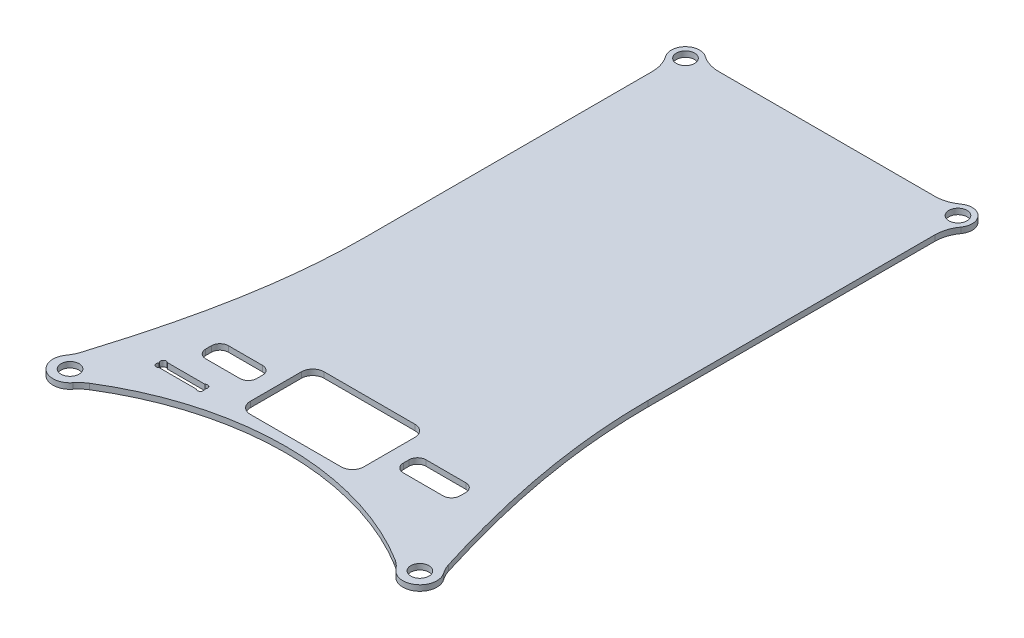
from build123d import *

# Parameters (mm, degrees)
COVER_MAIN_BOARD_1_START = 30
COVER_MAIN_BOARD_1_DEPTH = 1
SKETCH_2_R               = 2.5
SKETCH_2_R_2             = 3
EXTRUDE_1_DEPTH          = 1
FILLET_1_R               = 6
HOLE_WIZARD_M31_D        = 3.2
SKETCH_5_W               = 20
SKETCH_5_H               = 13
CUT_EXTRUDE_2_DEPTH      = 118.861812366
FILLET_2_R               = 2
CUT_EXTRUDE_3_DEPTH      = 118.861812366
SKETCH_7_W               = 10
SKETCH_7_H               = 4
SKETCH_7_W_2             = 9
CUT_EXTRUDE_4_DEPTH      = 118.861812366
FILLET_3_R               = 1.5


# Read off the part's stored shape, not the designer's step: Припуск-Cover_main_board-1
with BuildPart() as part:
    # Припуск-Cover_main_board-1 outline → Припуск-Cover_main_board-1 (new body)
    with BuildSketch(Plane(origin=(0, 0, 0), x_dir=(1, 0, 0), z_dir=(0, 1, 0)).offset(COVER_MAIN_BOARD_1_START)):
        with BuildLine():
            ThreePointArc((58.536662962, -97.610509717), (61.872887908, -97.542255565), (62.936422695, -94.379353532))
            add(Edge.make_bspline(
                [(62.936422695, -94.379353532), (61.798177223, -90.776493028), (60.72075986, -87.155811957), (58.774674414, -79.85329338), (57.908149184, -76.177190929), (56.466060339, -68.758031881), (55.893308454, -65.032046108), (55.109773151, -57.544971093), (54.899999704, -53.783069267), (54.9, -50)],
                knots=[0, 0, 0, 0, 0.25, 0.25, 0.5, 0.5, 0.75, 0.75, 1, 1, 1, 1], degree=3))
            Line((54.9, -50), (54.9, 6.4))
            Line((54.9, 6.4), (5.1, 6.4))
            Line((5.1, 6.4), (5.1, -50))
            add(Edge.make_bspline(
                [(5.1, -50), (5.099991031, -53.776486453), (4.890826579, -57.541590974), (4.10432522, -65.051764617), (3.53002006, -68.780548712), (2.088476888, -76.191600122), (1.222062078, -79.86132679), (-0.718312327, -87.143485068), (-1.7924779, -90.75713228), (-2.928662588, -94.354417399)],
                knots=[0, 0, 0, 0, 0.25, 0.25, 0.5, 0.5, 0.75, 0.75, 1, 1, 1, 1], degree=3))
            ThreePointArc((-2.928662588, -94.354417399), (-1.883263044, -97.534459074), (1.463338472, -97.610508751))
            ThreePointArc((1.463338472, -97.610508751), (30.000000864, -88.89999981), (58.536662962, -97.610509717))
        make_face()
    extrude(amount=COVER_MAIN_BOARD_1_DEPTH)

    # Эскиз2 → Бобышка-Вытянуть1 (add)
    with BuildSketch(Plane(origin=(0, 31, 0), x_dir=(1, 0, 0), z_dir=(0, 1, 0))):
        with Locations((6, 5.5)):
            Circle(SKETCH_2_R)
        with Locations((54, 5.5)):
            Circle(SKETCH_2_R)
        with Locations((-0.811267397, -96.088490424)):
            Circle(SKETCH_2_R_2)
        with Locations((60.811267397, -96.088490424)):
            Circle(SKETCH_2_R_2)
    extrude(amount=-EXTRUDE_1_DEPTH)

    # Скругление1
    fillet_1_edges = [part.edges().sort_by_distance(p)[0] for p in [
        (-2.75519034, 30.5, 93.803503862),
        (1.934506666, 30.5, 97.297094907),
        (58.065493335, 30.5, 97.297094908),
        (62.755023846, 30.5, 93.803362229),
        (54.9, 30.5, -3.167619242),
        (51.667619242, 30.5, -6.4),
        (8.332380758, 30.5, -6.4),
        (5.1, 30.5, -3.167619242),
    ]]
    fillet(fillet_1_edges, radius=FILLET_1_R)

    # Отверстие с зазором M31 (through all)
    with Locations(Plane(origin=(0, 31, 0), x_dir=(1, 0, 0), z_dir=(0, 1, 0))):
        with Locations((-0.811267397, -96.088490424), (60.811267397, -96.088490424), (54, 5.5), (6, 5.5)):
            Hole(HOLE_WIZARD_M31_D / 2)

    # Эскиз5 → Вырез-Вытянуть2 (cut, through all)
    with BuildSketch(Plane.XZ.offset(-30)):
        with Locations((30, 80.64999981)):
            Rectangle(SKETCH_5_W, SKETCH_5_H)
    extrude(amount=-CUT_EXTRUDE_2_DEPTH, mode=Mode.SUBTRACT)

    # Скругление2
    fillet_2_edges = [part.edges().sort_by_distance(p)[0] for p in [
        (40, 30.5, 87.14999981),
        (40, 30.5, 74.14999981),
        (20, 30.5, 74.14999981),
        (20, 30.5, 87.14999981),
    ]]
    fillet(fillet_2_edges, radius=FILLET_2_R)

    # Эскиз6 → Вырез-Вытянуть3 (cut, through all)
    with BuildSketch(Plane.XZ.offset(-30)):
        with BuildLine():
            Line((6.807106781, 88.05), (13.392893219, 88.05))
            ThreePointArc((13.392893219, 88.05), (14.1, 88.05), (14.1, 87.342893219))
            Line((14.1, 87.342893219), (14.1, 87.257106781))
            ThreePointArc((14.1, 87.257106781), (14.1, 86.55), (13.392893219, 86.55))
            Line((13.392893219, 86.55), (6.807106781, 86.55))
            ThreePointArc((6.807106781, 86.55), (6.1, 86.55), (6.1, 87.257106781))
            Line((6.1, 87.257106781), (6.1, 87.342893219))
            ThreePointArc((6.1, 87.342893219), (6.1, 88.05), (6.807106781, 88.05))
        make_face()
    extrude(amount=-CUT_EXTRUDE_3_DEPTH, mode=Mode.SUBTRACT)

    # Эскиз7 → Вырез-Вытянуть4 (cut, through all)
    with BuildSketch(Plane.XZ.offset(-30)):
        with Locations((47.9, 80.6)):
            Rectangle(SKETCH_7_W, SKETCH_7_H)
        with Locations((12.6, 80.6)):
            Rectangle(SKETCH_7_W_2, SKETCH_7_H)
    extrude(amount=-CUT_EXTRUDE_4_DEPTH, mode=Mode.SUBTRACT)

    # Скругление3
    fillet_3_edges = [part.edges().sort_by_distance(p)[0] for p in [
        (42.9, 30.5, 78.6),
        (42.9, 30.5, 82.6),
        (52.9, 30.5, 82.6),
        (52.9, 30.5, 78.6),
        (17.1, 30.5, 82.6),
        (17.1, 30.5, 78.6),
        (8.1, 30.5, 78.6),
        (8.1, 30.5, 82.6),
    ]]
    fillet(fillet_3_edges, radius=FILLET_3_R)


solid = part.part
